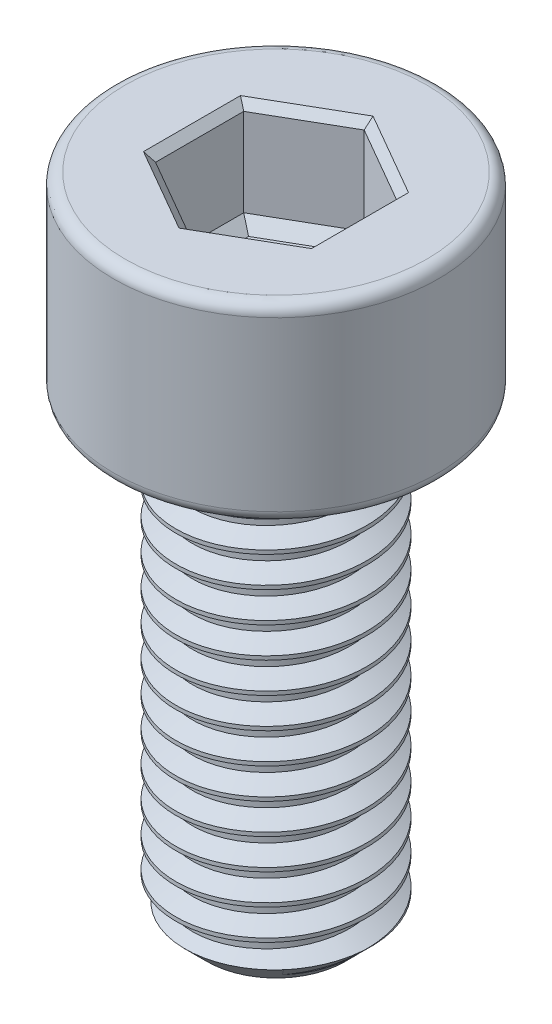
from build123d import *

# Parameters (mm, degrees)
SKETCH1_R           = 2.5
BOSS_EXTRUDE1_DEPTH = 12
THREAD1_PITCH       = 0.8
SKETCH5_R           = 4.25
BOSS_EXTRUDE2_DEPTH = 5
FILLET1_R           = 0.3
CUT_EXTRUDE1_DEPTH  = 2.5
CHAMFER1_SIZE       = 0.2
CUT_EXTRUDE2_DEPTH  = 0.3
CUT_EXTRUDE2_DRAFT  = -45


with BuildPart() as part:
    # Sketch1 → Boss-Extrude1 (new body)
    with BuildSketch(Plane(origin=(0, 0, 0), x_dir=(1, 0, 0), z_dir=(0, 1, 0))):
        with Locations(Location((0, 0, 0), (0, 0, 270))):
            Circle(SKETCH1_R)
    extrude(amount=BOSS_EXTRUDE1_DEPTH)

    # Thread1: the profile of Thread Profile1 profile screwed along a right-hand helix of 16.25 turns, 8 arcs to a turn; built about Z, then put on its axis
    thread1_z = Axis((0, 0, 0), (0, 0, 1))
    thread1_corners = [(2.5003, 0, -0.000173205), (2.5003, 0, 0.700173203), (2.0669873, 0, 0.449999999), (2.0669873, 0, 0.249999999)]
    with BuildLine(mode=Mode.PRIVATE) as thread1_profile:
        Line(thread1_corners[0], thread1_corners[1])
        Line(thread1_corners[1], thread1_corners[2])
        Line(thread1_corners[2], thread1_corners[3])
        Line(thread1_corners[3], thread1_corners[0])
    thread1_cap = Face(thread1_profile.wire())
    thread1_turn_angles = [0, 22.5, 45, 67.5, 90, 112.5, 135, 157.5, 180, 202.5, 225, 247.5, 270, 292.5, 315, 337.5, 360]
    thread1_turn_weights = [1, 0.9238795325112867, 1, 0.9238795325112867, 1, 0.9238795325112867, 1, 0.9238795325112867, 1, 0.9238795325112867, 1, 0.9238795325112867, 1, 0.9238795325112867, 1, 0.9238795325112867, 1]
    thread1_turn_rails = [Edge.make_bspline([Vector(p[0], p[1], 0).rotate(thread1_z, thread1_turn_angles[k]) / thread1_turn_weights[k] + Vector(0, 0, p[2] + THREAD1_PITCH * thread1_turn_angles[k] / 360) for k in range(17)], [0, 0, 0, 1, 1, 2, 2, 3, 3, 4, 4, 5, 5, 6, 6, 7, 7, 8, 8, 8], 2, thread1_turn_weights) for p in thread1_corners]
    thread1_turn_sides = [Face.make_surface_from_curves(thread1_turn_rails[p[0]], thread1_turn_rails[p[1]]) for p in [(0, 1), (1, 2), (2, 3), (3, 0)]]
    thread1_last_angles = [5760, 5782.5, 5805, 5827.5, 5850]
    thread1_last_weights = [1, 0.9238795325112867, 1, 0.9238795325112837, 1]
    thread1_last_rails = [Edge.make_bspline([Vector(p[0], p[1], 0).rotate(thread1_z, thread1_last_angles[k]) / thread1_last_weights[k] + Vector(0, 0, p[2] + THREAD1_PITCH * thread1_last_angles[k] / 360) for k in range(5)], [0, 0, 0, 1, 1, 2, 2, 2], 2, thread1_last_weights) for p in thread1_corners]
    thread1_last_sides = [Face.make_surface_from_curves(thread1_last_rails[p[0]], thread1_last_rails[p[1]]) for p in [(0, 1), (1, 2), (2, 3), (3, 0)]]
    thread1 = Plane(origin=(0, 13, 0), x_dir=(-1, 0, 0), z_dir=(0, -1, 0)) * Solid(Shell([*[p.moved(Location((0, 0, THREAD1_PITCH * i))) for i in range(16) for p in thread1_turn_sides], *thread1_last_sides, thread1_cap, thread1_cap.rotate(thread1_z, 5850).moved(Location((0, 0, THREAD1_PITCH * 5850 / 360)))]))
    add(thread1, mode=Mode.SUBTRACT)

    # Sketch5 → Boss-Extrude2 (add)
    with BuildSketch(Plane(origin=(0, 12, 0), x_dir=(1, 0, 0), z_dir=(0, 1, 0))):
        with Locations(Location((0, 0, 0), (0, 0, 270))):
            Circle(SKETCH5_R)
    extrude(amount=BOSS_EXTRUDE2_DEPTH)

    # Fillet1
    fillet1_edges = [part.edges().sort_by_distance(p)[0] for p in [
        (0, 12, -4.25),
        (0, 17, -4.25),
    ]]
    fillet(fillet1_edges, radius=FILLET1_R)

    # Sketch6 → Cut-Revolve1 (revolve, cut)
    with BuildSketch(Plane.XY, mode=Mode.PRIVATE) as cut_revolve1_sk:
        Polygon((2.51, 0), (2.51, 0.7), (1.81, 0), align=None)
    revolve(cut_revolve1_sk.sketch.rotate(Axis((0, 0, 0), (0, 1, 0)), 318.279472978), axis=Axis((0, 0, 0), (0, 1, 0)), mode=Mode.SUBTRACT)

    # Sketch7 → Cut-Extrude1 (cut)
    with BuildSketch(Plane(origin=(0, 17, 0), x_dir=(1, 0, 0), z_dir=(0, 1, 0))):
        Polygon((0, 2.309401077), (-2, 1.154700538), (-2, -1.154700538), (0, -2.309401077), (2, -1.154700538), (2, 1.154700538), align=None)
    extrude(amount=-CUT_EXTRUDE1_DEPTH, mode=Mode.SUBTRACT)

    # Chamfer1
    chamfer1_edges = [part.edges().sort_by_distance(p)[0] for p in [
        (1, 17, -1.732050808),
        (-1, 17, -1.732050808),
        (-2, 17, 0),
        (-1, 17, 1.732050808),
        (1, 17, 1.732050808),
        (2, 17, 0),
    ]]
    chamfer(chamfer1_edges, length=CHAMFER1_SIZE)


with BuildPart() as cut_extrude2_tool:
    # Sketch8 → Cut-Extrude2 (with draft: the straight prism first)
    with BuildSketch(Plane(origin=(0, 14.5, 0), x_dir=(1, 0, 0), z_dir=(0, 1, 0))):
        Polygon((0, 2.309401077), (-2, 1.154700538), (-2, -1.154700538), (0, -2.309401077), (2, -1.154700538), (2, 1.154700538), align=None)
    extrude(amount=-CUT_EXTRUDE2_DEPTH)
    # Cut-Extrude2: the draft: its side faces are tilted about the plane it starts from
    cut_extrude2_sides = [cut_extrude2_tool.faces().sort_by_distance(p)[0] for p in [
        (-1, 14.35, -1.732050808),
        (-2, 14.35, 0),
        (-1, 14.35, 1.732050808),
        (1, 14.35, 1.732050808),
        (2, 14.35, 0),
        (1, 14.35, -1.732050808),
    ]]
    draft(cut_extrude2_sides, Plane(origin=(0, 14.5, 0), x_dir=(1, 0, 0), z_dir=(0, 1, 0)), CUT_EXTRUDE2_DRAFT)


with BuildPart() as part_1:
    add(part.part)

    # Cut-Extrude2: cut by cut_extrude2_tool
    add(cut_extrude2_tool.part, mode=Mode.SUBTRACT)


solid = part_1.part
